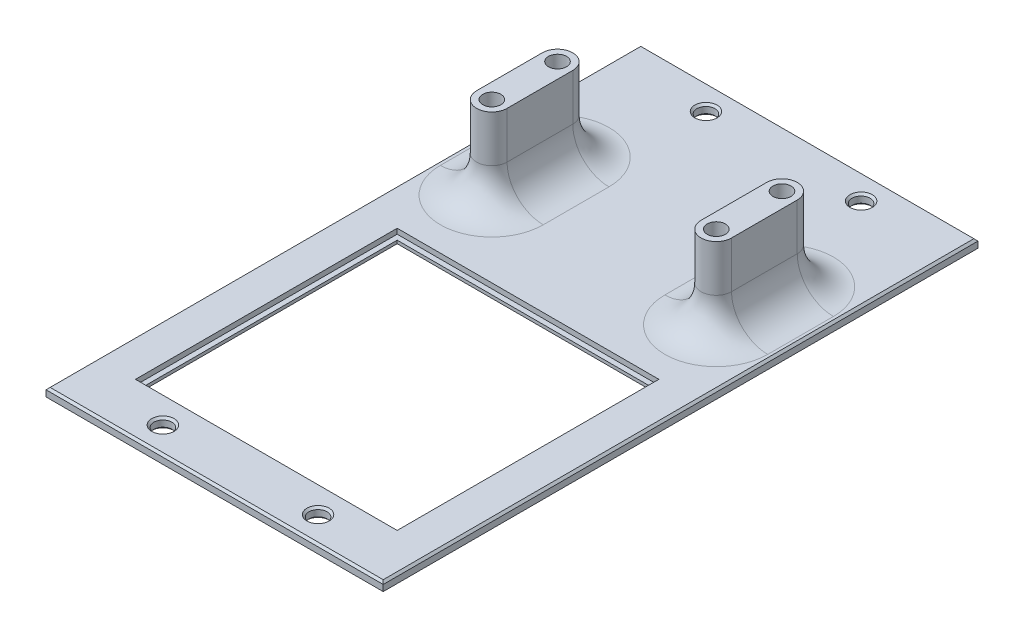
from build123d import *

# Parameters (mm, degrees)
SKETCH1_W           = 65.2
SKETCH1_H           = 115
SKETCH1_R           = 1.75
SKETCH1_W_2         = 48.6
SKETCH1_H_2         = 48.6
BOSS_EXTRUDE1_DEPTH = 1
SKETCH3_W           = 65.2
SKETCH3_H           = 115
SKETCH3_R           = 1.75
SKETCH3_W_2         = 50.6
SKETCH3_H_2         = 50.6
BOSS_EXTRUDE2_DEPTH = 1
SKETCH4_R           = 1.75
BOSS_EXTRUDE3_DEPTH = 16
FILLET1_R           = 7
CUT_EXTRUDE1_START  = -18
SKETCH5_R           = 1.75
CUT_EXTRUDE1_DEPTH  = 18
CUT_EXTRUDE2_DEPTH  = 3
CHAMFER1_SIZE       = 1.6
CHAMFER2_SIZE       = 0.4


with BuildPart() as part:
    # Sketch1 → Boss-Extrude1 (new body)
    with BuildSketch(Plane(origin=(0, 0, 0), x_dir=(1, 0, 0), z_dir=(0, 1, 0))):
        Rectangle(SKETCH1_W, SKETCH1_H)
        with Locations(Location((-15, 52.5, 0), (0, 0, 270))):
            Circle(SKETCH1_R, mode=Mode.SUBTRACT)
        with Locations(Location((15, 52.5, 0), (0, 0, 270))):
            Circle(SKETCH1_R, mode=Mode.SUBTRACT)
        with Locations(Location((15, -52.5, 0), (0, 0, 270))):
            Circle(SKETCH1_R, mode=Mode.SUBTRACT)
        with Locations(Location((-15, -52.5, 0), (0, 0, 270))):
            Circle(SKETCH1_R, mode=Mode.SUBTRACT)
        with Locations((0, -22.2)):
            Rectangle(SKETCH1_W_2, SKETCH1_H_2, mode=Mode.SUBTRACT)
    extrude(amount=BOSS_EXTRUDE1_DEPTH)

    # Sketch3 → Boss-Extrude2 (add)
    with BuildSketch(Plane(origin=(0, 1, 0), x_dir=(1, 0, 0), z_dir=(0, 1, 0))):
        Rectangle(SKETCH3_W, SKETCH3_H)
        with Locations(Location((-15, -52.5, 0), (0, 0, 270))):
            Circle(SKETCH3_R, mode=Mode.SUBTRACT)
        with Locations(Location((15, -52.5, 0), (0, 0, 270))):
            Circle(SKETCH3_R, mode=Mode.SUBTRACT)
        with Locations(Location((15, 52.5, 0), (0, 0, 270))):
            Circle(SKETCH3_R, mode=Mode.SUBTRACT)
        with Locations(Location((-15, 52.5, 0), (0, 0, 270))):
            Circle(SKETCH3_R, mode=Mode.SUBTRACT)
        with Locations((0, -22.2)):
            Rectangle(SKETCH3_W_2, SKETCH3_H_2, mode=Mode.SUBTRACT)
    extrude(amount=BOSS_EXTRUDE2_DEPTH)

    # Sketch4 → Boss-Extrude3 (add)
    # profile 1 of 2: a face of its own
    with BuildSketch(Plane(origin=(0, 2, 0), x_dir=(1, 0, 0), z_dir=(0, 1, 0))):
        with BuildLine():
            Line((-18.75, 30.5), (-18.75, 17.8))
            ThreePointArc((-18.75, 17.8), (-21.7, 14.85), (-24.65, 17.8))
            Line((-24.65, 17.8), (-24.65, 30.5))
            ThreePointArc((-24.65, 30.5), (-21.7, 33.45), (-18.75, 30.5))
        make_face()
        with Locations(Location((-21.7, 30.5, 0), (0, 0, 270))):
            Circle(SKETCH4_R, mode=Mode.SUBTRACT)
        with Locations(Location((-21.7, 17.8, 0), (0, 0, 270))):
            Circle(SKETCH4_R, mode=Mode.SUBTRACT)
    # profile 2 of 2: a face of its own
    with BuildSketch(Plane(origin=(0, 2, 0), x_dir=(1, 0, 0), z_dir=(0, 1, 0))):
        with BuildLine():
            Line((24.65, 30.5), (24.65, 17.8))
            ThreePointArc((24.65, 17.8), (21.7, 14.85), (18.75, 17.8))
            Line((18.75, 17.8), (18.75, 30.5))
            ThreePointArc((18.75, 30.5), (21.7, 33.45), (24.65, 30.5))
        make_face()
        with Locations(Location((21.7, 17.8, 0), (0, 0, 270))):
            Circle(SKETCH4_R, mode=Mode.SUBTRACT)
        with Locations(Location((21.7, 30.5, 0), (0, 0, 270))):
            Circle(SKETCH4_R, mode=Mode.SUBTRACT)
    extrude(amount=BOSS_EXTRUDE3_DEPTH)

    # Fillet1
    fillet1_edges = [part.edges().sort_by_distance(p)[0] for p in [
        (21.7, 2, -33.45),
        (18.75, 2, -24.15),
        (21.7, 2, -14.85),
        (24.65, 2, -24.15),
        (-21.7, 2, -33.45),
        (-24.65, 2, -24.15),
        (-21.7, 2, -14.85),
        (-18.75, 2, -24.15),
    ]]
    fillet(fillet1_edges, radius=FILLET1_R)

    # Sketch5 → Cut-Extrude1 (cut)
    with BuildSketch(Plane(origin=(0, 18, 0), x_dir=(1, 0, 0), z_dir=(0, 1, 0)).offset(CUT_EXTRUDE1_START)):
        with Locations(Location((21.7, 30.5, 0), (0, 0, 270))):
            Circle(SKETCH5_R)
        with Locations(Location((21.7, 17.8, 0), (0, 0, 270))):
            Circle(SKETCH5_R)
        with Locations(Location((-21.7, 17.8, 0), (0, 0, 270))):
            Circle(SKETCH5_R)
        with Locations(Location((-21.7, 30.5, 0), (0, 0, 270))):
            Circle(SKETCH5_R)
    extrude(amount=CUT_EXTRUDE1_DEPTH, mode=Mode.SUBTRACT)

    # Sketch6 → Cut-Extrude2 (cut)
    with BuildSketch(Plane.XZ):
        Polygon((-18.95, -16.21228676), (-21.7, -14.624573519), (-24.45, -16.21228676), (-24.45, -19.38771324), (-21.7, -20.975426481), (-18.95, -19.38771324), align=None)
        Polygon((-18.95, -28.91228676), (-21.7, -27.324573519), (-24.45, -28.91228676), (-24.45, -32.08771324), (-21.7, -33.675426481), (-18.95, -32.08771324), align=None)
        Polygon((18.95, -28.91228676), (18.95, -32.08771324), (21.7, -33.675426481), (24.45, -32.08771324), (24.45, -28.91228676), (21.7, -27.324573519), align=None)
        Polygon((18.95, -16.21228676), (18.95, -19.38771324), (21.7, -20.975426481), (24.45, -19.38771324), (24.45, -16.21228676), (21.7, -14.624573519), align=None)
    extrude(amount=-CUT_EXTRUDE2_DEPTH, mode=Mode.SUBTRACT)

    # Chamfer1
    # the kernel refuses this chamfer: 1.6 mm, written as the material it takes off along each edge
    with BuildSketch(Plane(origin=(21.7, 3, -30.5), x_dir=(0, 0, 1), z_dir=(1, 0, 0))) as chamfer1_piece_1_section:
        Polygon((1.75, -CHAMFER1_SIZE), (1.75 + CHAMFER1_SIZE, 0), (1.75, 0), align=None)
    chamfer1_piece_1 = revolve(axis=Axis((21.7, 3, -30.5), (0, -1, 0)), mode=Mode.PRIVATE)
    chamfer1_piece_1 = split(chamfer1_piece_1, bisect_by=Plane(origin=(18.95, 3.891589567, -32.921761213), z_dir=(1, 0, 0)), keep=Keep.TOP, mode=Mode.PRIVATE)
    chamfer1_piece_1 = split(chamfer1_piece_1, bisect_by=Plane(origin=(21.373653366, 3.891589567, -33.487010164), z_dir=(0.49999999999999994, 0, 0.8660254037844389)), keep=Keep.TOP, mode=Mode.PRIVATE)
    chamfer1_piece_1 = split(chamfer1_piece_1, bisect_by=Plane(origin=(22.026346634, 3.891589567, -33.487010164), z_dir=(-0.5000000000000021, 0, 0.8660254037844375)), keep=Keep.TOP, mode=Mode.PRIVATE)
    chamfer1_piece_1 = split(chamfer1_piece_1, bisect_by=Plane(origin=(24.45, 3.891589567, -32.921761213), z_dir=(-1, 0, 0)), keep=Keep.TOP, mode=Mode.PRIVATE)
    chamfer1_piece_1 = split(chamfer1_piece_1, bisect_by=Plane(origin=(24.123653366, 3.891589567, -28.723870443), z_dir=(-0.49999999999999967, 0, -0.8660254037844389)), keep=Keep.TOP, mode=Mode.PRIVATE)
    chamfer1_piece_1 = split(chamfer1_piece_1, bisect_by=Plane(origin=(19.276346634, 3.891589567, -28.723870443), z_dir=(0.4999999999999998, 0, -0.8660254037844388)), keep=Keep.TOP, mode=Mode.PRIVATE)
    add(chamfer1_piece_1, mode=Mode.SUBTRACT)
    with BuildSketch(Plane(origin=(21.7, 3, -17.8), x_dir=(0, 0, 1), z_dir=(1, 0, 0))) as chamfer1_piece_2_section:
        Polygon((1.75, -CHAMFER1_SIZE), (1.75 + CHAMFER1_SIZE, 0), (1.75, 0), align=None)
    chamfer1_piece_2 = revolve(axis=Axis((21.7, 3, -17.8), (0, -1, 0)), mode=Mode.PRIVATE)
    chamfer1_piece_2 = split(chamfer1_piece_2, bisect_by=Plane(origin=(18.95, 3.891589567, -20.221761213), z_dir=(1, 0, 0)), keep=Keep.TOP, mode=Mode.PRIVATE)
    chamfer1_piece_2 = split(chamfer1_piece_2, bisect_by=Plane(origin=(21.373653366, 3.891589567, -20.787010164), z_dir=(0.5, 0, 0.8660254037844387)), keep=Keep.TOP, mode=Mode.PRIVATE)
    chamfer1_piece_2 = split(chamfer1_piece_2, bisect_by=Plane(origin=(22.026346634, 3.891589567, -20.787010164), z_dir=(-0.49999999999999944, 0, 0.866025403784439)), keep=Keep.TOP, mode=Mode.PRIVATE)
    chamfer1_piece_2 = split(chamfer1_piece_2, bisect_by=Plane(origin=(24.45, 3.891589567, -20.221761213), z_dir=(-1, 0, 0)), keep=Keep.TOP, mode=Mode.PRIVATE)
    chamfer1_piece_2 = split(chamfer1_piece_2, bisect_by=Plane(origin=(24.123653366, 3.891589567, -16.023870443), z_dir=(-0.5000000000000001, 0, -0.8660254037844386)), keep=Keep.TOP, mode=Mode.PRIVATE)
    chamfer1_piece_2 = split(chamfer1_piece_2, bisect_by=Plane(origin=(19.276346634, 3.891589567, -16.023870443), z_dir=(0.49999999999999856, 0, -0.8660254037844396)), keep=Keep.TOP, mode=Mode.PRIVATE)
    add(chamfer1_piece_2, mode=Mode.SUBTRACT)
    with BuildSketch(Plane(origin=(-21.7, 3, -17.8), x_dir=(0, 0, 1), z_dir=(1, 0, 0))) as chamfer1_piece_3_section:
        Polygon((1.75 + CHAMFER1_SIZE, 0), (1.75, -CHAMFER1_SIZE), (1.75, 0), align=None)
    chamfer1_piece_3 = revolve(axis=Axis((-21.7, 3, -17.8), (0, -1, 0)), mode=Mode.PRIVATE)
    chamfer1_piece_3 = split(chamfer1_piece_3, bisect_by=Plane(origin=(-19.276346634, 3.891589567, -16.023870443), z_dir=(-0.5000000000000001, 0, -0.8660254037844386)), keep=Keep.TOP, mode=Mode.PRIVATE)
    chamfer1_piece_3 = split(chamfer1_piece_3, bisect_by=Plane(origin=(-24.123653366, 3.891589567, -16.023870443), z_dir=(0.49999999999999967, 0, -0.8660254037844389)), keep=Keep.TOP, mode=Mode.PRIVATE)
    chamfer1_piece_3 = split(chamfer1_piece_3, bisect_by=Plane(origin=(-24.45, 3.891589567, -20.221761213), z_dir=(1, 0, 0)), keep=Keep.TOP, mode=Mode.PRIVATE)
    chamfer1_piece_3 = split(chamfer1_piece_3, bisect_by=Plane(origin=(-22.026346634, 3.891589567, -20.787010164), z_dir=(0.49999999999999967, 0, 0.8660254037844389)), keep=Keep.TOP, mode=Mode.PRIVATE)
    chamfer1_piece_3 = split(chamfer1_piece_3, bisect_by=Plane(origin=(-21.373653366, 3.891589567, -20.787010164), z_dir=(-0.5000000000000001, 0, 0.8660254037844386)), keep=Keep.TOP, mode=Mode.PRIVATE)
    chamfer1_piece_3 = split(chamfer1_piece_3, bisect_by=Plane(origin=(-18.95, 3.891589567, -20.221761213), z_dir=(-1, 0, 0)), keep=Keep.TOP, mode=Mode.PRIVATE)
    add(chamfer1_piece_3, mode=Mode.SUBTRACT)
    with BuildSketch(Plane(origin=(-21.7, 3, -30.5), x_dir=(0, 0, 1), z_dir=(1, 0, 0))) as chamfer1_piece_4_section:
        Polygon((1.75 + CHAMFER1_SIZE, 0), (1.75, -CHAMFER1_SIZE), (1.75, 0), align=None)
    chamfer1_piece_4 = revolve(axis=Axis((-21.7, 3, -30.5), (0, -1, 0)), mode=Mode.PRIVATE)
    chamfer1_piece_4 = split(chamfer1_piece_4, bisect_by=Plane(origin=(-19.276346634, 3.891589567, -28.723870443), z_dir=(-0.4999999999999998, 0, -0.8660254037844388)), keep=Keep.TOP, mode=Mode.PRIVATE)
    chamfer1_piece_4 = split(chamfer1_piece_4, bisect_by=Plane(origin=(-24.123653366, 3.891589567, -28.723870443), z_dir=(0.49999999999999994, 0, -0.8660254037844389)), keep=Keep.TOP, mode=Mode.PRIVATE)
    chamfer1_piece_4 = split(chamfer1_piece_4, bisect_by=Plane(origin=(-24.45, 3.891589567, -32.921761213), z_dir=(1, 0, 0)), keep=Keep.TOP, mode=Mode.PRIVATE)
    chamfer1_piece_4 = split(chamfer1_piece_4, bisect_by=Plane(origin=(-22.026346634, 3.891589567, -33.487010164), z_dir=(0.49999999999999994, 0, 0.8660254037844389)), keep=Keep.TOP, mode=Mode.PRIVATE)
    chamfer1_piece_4 = split(chamfer1_piece_4, bisect_by=Plane(origin=(-21.373653366, 3.891589567, -33.487010164), z_dir=(-0.5000000000000023, 0, 0.8660254037844374)), keep=Keep.TOP, mode=Mode.PRIVATE)
    chamfer1_piece_4 = split(chamfer1_piece_4, bisect_by=Plane(origin=(-18.95, 3.891589567, -32.921761213), z_dir=(-1, 0, 0)), keep=Keep.TOP, mode=Mode.PRIVATE)
    add(chamfer1_piece_4, mode=Mode.SUBTRACT)

    # Chamfer2
    chamfer2_edges = [part.edges().sort_by_distance(p)[0] for p in [
        (0, 0, -2.1),
        (-24.3, 0, 22.2),
        (0, 0, 46.5),
        (24.3, 0, 22.2),
        (20.325, 0, -15.41843014),
        (18.95, 0, -17.8),
        (20.325, 0, -20.18156986),
        (23.075, 0, -20.18156986),
        (24.45, 0, -17.8),
        (23.075, 0, -15.41843014),
        (20.325, 0, -28.11843014),
        (18.95, 0, -30.5),
        (20.325, 0, -32.88156986),
        (23.075, 0, -32.88156986),
        (24.45, 0, -30.5),
        (23.075, 0, -28.11843014),
        (-18.95, 0, -30.5),
        (-20.325, 0, -28.11843014),
        (-23.075, 0, -28.11843014),
        (-24.45, 0, -30.5),
        (-23.075, 0, -32.88156986),
        (-20.325, 0, -32.88156986),
        (-18.95, 0, -17.8),
        (-20.325, 0, -15.41843014),
        (-23.075, 0, -15.41843014),
        (-24.45, 0, -17.8),
        (-23.075, 0, -20.18156986),
        (-20.325, 0, -20.18156986),
        (-15, 0, -54.25),
        (15, 0, -54.25),
        (15, 0, 50.75),
        (-15, 0, 50.75),
        (0, 2, -57.5),
        (-32.6, 2, 0),
        (0, 2, 57.5),
        (32.6, 2, 0),
        (0, 0, -57.5),
        (-15, 2, 50.75),
        (15, 2, 50.75),
        (15, 2, -54.25),
        (-15, 2, -54.25),
        (32.6, 0, 0),
        (0, 0, 57.5),
        (-32.6, 0, 0),
    ]]
    chamfer(chamfer2_edges, length=CHAMFER2_SIZE)


solid = part.part
